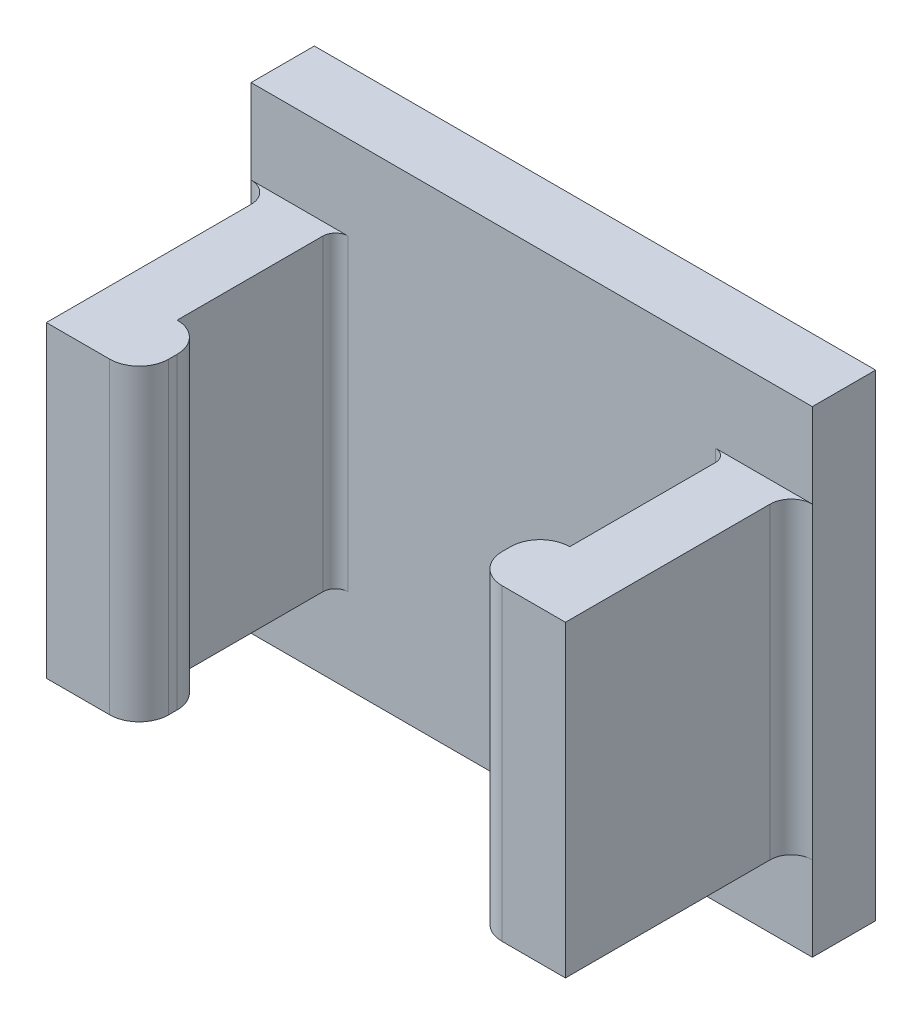
from build123d import *

# Parameters (mm, degrees)
SKETCH_1_W          = 12.3
SKETCH_1_H          = 11.3
EXTRUDE_1_DEPTH     = 2.5
SKETCH_2_W          = 1.5
SKETCH_2_H          = 11.3
EXTRUDE_2_DEPTH     = 4.35
SKETCH_5_W          = 9.3
SKETCH_5_H          = 11.5
CUT_EXTRUDE_1_DEPTH = 1
SKETCH_8_W          = 1.6
SKETCH_8_H          = 11.3
EXTRUDE_5_DEPTH     = 0.7
SKETCH_9_W          = 1.6
SKETCH_9_H          = 11.3
EXTRUDE_6_DEPTH     = 0.7
FILLET_8_R          = 0.3
SKETCH_11_W         = 12.3
SKETCH_11_H         = 5.35
CUT_EXTRUDE_2_DEPTH = 2
SKETCH_12_W         = 12.3
SKETCH_12_H         = 5.35
CUT_EXTRUDE_3_DEPTH = 2
SKETCH_13_W         = 1.5
SKETCH_13_H         = 11.3
EXTRUDE_7_DEPTH     = 0.5
SKETCH_14_W         = 1.5
SKETCH_14_H         = 11.3
EXTRUDE_8_DEPTH     = 0.5
FILLET_9_R          = 0.5
FILLET_10_R         = 0.7


with BuildPart() as part:
    # 스케치1 → 보스-돌출1 (new body)
    with BuildSketch(Plane.XY):
        Rectangle(SKETCH_1_W, SKETCH_1_H)
    extrude(amount=EXTRUDE_1_DEPTH)

    # 스케치2 → 보스-돌출2 (add)
    with BuildSketch(Plane.XY.offset(2.5)):
        with Locations((-5.4, 0)):
            Rectangle(SKETCH_2_W, SKETCH_2_H)
        with Locations((5.4, 0)):
            Rectangle(SKETCH_2_W, SKETCH_2_H)
    extrude(amount=EXTRUDE_2_DEPTH)

    # 스케치5 → 컷-돌출1 (cut)
    with BuildSketch(Plane.XY.offset(2.5)):
        Rectangle(SKETCH_5_W, SKETCH_5_H)
    extrude(amount=-CUT_EXTRUDE_1_DEPTH, mode=Mode.SUBTRACT)

    # 스케치8 → 보스-돌출5 (add)
    with BuildSketch(Plane(origin=(-4.65, 0, 0), x_dir=(0, 0, -1), z_dir=(1, 0, 0))):
        with Locations((-6.05, 0)):
            Rectangle(SKETCH_8_W, SKETCH_8_H)
    extrude(amount=EXTRUDE_5_DEPTH)

    # 스케치9 → 보스-돌출6 (add)
    with BuildSketch(Plane.ZY.offset(-4.65)):
        with Locations((6.05, 0)):
            Rectangle(SKETCH_9_W, SKETCH_9_H)
    extrude(amount=EXTRUDE_6_DEPTH)

    # 필렛8
    fillet_8_edges = [part.edges().sort_by_distance(p)[0] for p in [
        (4.65, 0, 1.5),
        (-4.65, 0, 1.5),
    ]]
    fillet(fillet_8_edges, radius=FILLET_8_R)

    # 스케치11 → 컷-돌출2 (cut)
    with BuildSketch(Plane(origin=(0, 5.65, 0), x_dir=(1, 0, 0), z_dir=(0, 1, 0))):
        with Locations((0, -4.175)):
            Rectangle(SKETCH_11_W, SKETCH_11_H)
    extrude(amount=-CUT_EXTRUDE_2_DEPTH, mode=Mode.SUBTRACT)

    # 스케치12 → 컷-돌출3 (cut)
    with BuildSketch(Plane.XZ.offset(5.65)):
        with Locations((0, 4.175)):
            Rectangle(SKETCH_12_W, SKETCH_12_H)
    extrude(amount=-CUT_EXTRUDE_3_DEPTH, mode=Mode.SUBTRACT)

    # 스케치13 → 보스-돌출7 (add)
    with BuildSketch(Plane(origin=(6.15, 0, 0), x_dir=(0, 0, -1), z_dir=(1, 0, 0))):
        with Locations((-0.75, 0)):
            Rectangle(SKETCH_13_W, SKETCH_13_H)
    extrude(amount=EXTRUDE_7_DEPTH)

    # 스케치14 → 보스-돌출8 (add)
    with BuildSketch(Plane.ZY.offset(6.15)):
        with Locations((0.75, 0)):
            Rectangle(SKETCH_14_W, SKETCH_14_H)
    extrude(amount=EXTRUDE_8_DEPTH)

    # 필렛9
    fillet_9_edges = [part.edges().sort_by_distance(p)[0] for p in [
        (6.15, 0, 1.5),
        (-6.15, 0, 1.5),
    ]]
    fillet(fillet_9_edges, radius=FILLET_9_R - 0.0001)  # a hair under: the kernel refuses the full size

    # 필렛10
    fillet_10_edges = [part.edges().sort_by_distance(p)[0] for p in [
        (-3.95, 0, 6.85),
        (-3.95, 0, 5.25),
        (3.95, 0, 5.25),
        (3.95, 0, 6.85),
    ]]
    fillet(fillet_10_edges, radius=FILLET_10_R - 0.0001)  # a hair under: the kernel refuses the full size


solid = part.part
